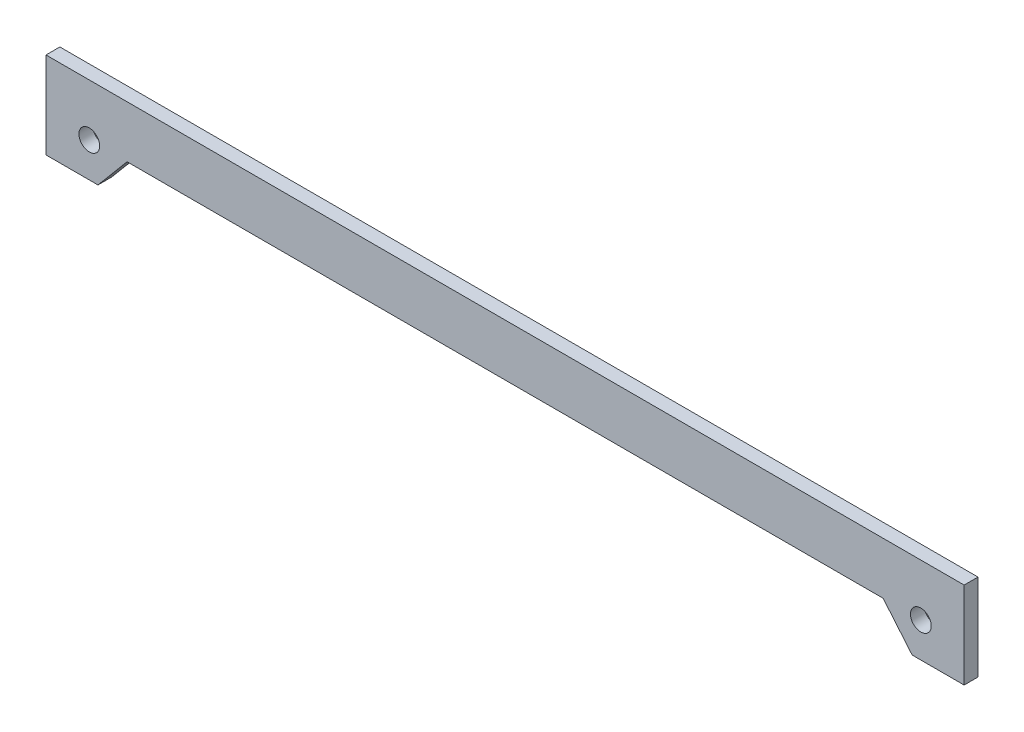
from build123d import *

# Parameters (mm, degrees)
GRUNDPLATTE_DEPTH               = 4
SKIZZE2_R                       = 3
SCHNITT_LINEAR_AUSTRAGEN1_DEPTH = 135.897183069


with BuildPart() as part:
    # Skizze1 → Grundplatte (new body)
    with BuildSketch(Plane.XY):
        Polygon((132.5, 0), (-132.5, 0), (-132.5, -25), (-117.5, -25), (-109.109003688, -15), (109.109003688, -15), (117.5, -25), (132.5, -25), align=None)
    extrude(amount=GRUNDPLATTE_DEPTH)

    # Skizze2 → Schnitt-Linear austragen1 (cut, through all)
    with BuildSketch(Plane.XY.offset(4)):
        with Locations((-120, -15)):
            Circle(SKIZZE2_R)
        with Locations((120, -15)):
            Circle(SKIZZE2_R)
    extrude(amount=-SCHNITT_LINEAR_AUSTRAGEN1_DEPTH, mode=Mode.SUBTRACT)


solid = part.part
